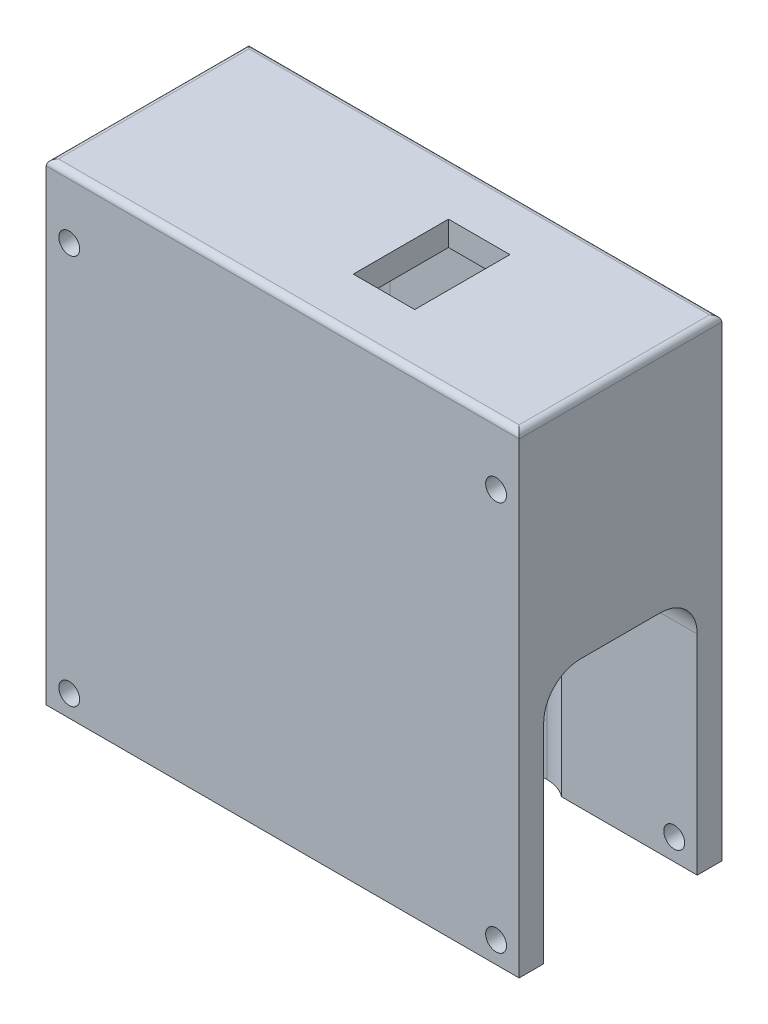
from build123d import *

# Parameters (mm, degrees)
SKETCH_1_W          = 77
SKETCH_1_H          = 33
EXTRUDE_1_DEPTH     = 77
CUT_EXTRUDE_1_DEPTH = 73
SKETCH_3_R          = 1.7
CUT_EXTRUDE_2_DEPTH = 93.196800378
CUT_EXTRUDE_3_DEPTH = 111.13741417
SKETCH_5_W          = 10
SKETCH_5_H          = 15.5
CUT_EXTRUDE_4_DEPTH = 85.163531427
FILLET_1_R          = 1


with BuildPart() as part:
    # ｽｹｯﾁ1 → ﾎﾞｽ - 押し出し1 (new body)
    with BuildSketch(Plane(origin=(0, 0, 0), x_dir=(1, 0, 0), z_dir=(0, 1, 0))):
        Rectangle(SKETCH_1_W, SKETCH_1_H)
    extrude(amount=EXTRUDE_1_DEPTH)

    # ｽｹｯﾁ2 → ｶｯﾄ - 押し出し1 (cut)
    with BuildSketch(Plane.XZ):
        with BuildLine():
            Line((12.75, 13.75), (-12.75, 13.75))
            ThreePointArc((-12.75, 13.75), (-16.992640687, 11.992640687), (-18.75, 7.75))
            Line((-18.75, 7.75), (-18.75, -7.75))
            ThreePointArc((-18.75, -7.75), (-16.992640687, -11.992640687), (-12.75, -13.75))
            Line((-12.75, -13.75), (12.75, -13.75))
            ThreePointArc((12.75, -13.75), (16.992640687, -11.992640687), (18.75, -7.75))
            Line((18.75, -7.75), (18.75, 7.75))
            ThreePointArc((18.75, 7.75), (16.992640687, 11.992640687), (12.75, 13.75))
        make_face()
    extrude(amount=-CUT_EXTRUDE_1_DEPTH, mode=Mode.SUBTRACT)

    # ｽｹｯﾁ3 → ｶｯﾄ - 押し出し2 (cut, through all)
    with BuildSketch(Plane.XY.offset(16.5)):
        with Locations((34.75, 3.5)):
            Circle(SKETCH_3_R)
        with Locations((34.75, 67)):
            Circle(SKETCH_3_R)
        with Locations((-34.75, 67)):
            Circle(SKETCH_3_R)
        with Locations((-34.75, 3.5)):
            Circle(SKETCH_3_R)
    extrude(amount=-CUT_EXTRUDE_2_DEPTH, mode=Mode.SUBTRACT)

    # ｽｹｯﾁ4 → ｶｯﾄ - 押し出し3 (cut, through all)
    with BuildSketch(Plane.ZY.offset(38.5)):
        with BuildLine():
            Line((6.5, 40), (-6.5, 40))
            ThreePointArc((-6.5, 40), (-10.742640687, 38.242640687), (-12.5, 34))
            Line((-12.5, 34), (-12.5, 0))
            Line((-12.5, 0), (12.5, 0))
            Line((12.5, 0), (12.5, 34))
            ThreePointArc((12.5, 34), (10.742640687, 38.242640687), (6.5, 40))
        make_face()
    extrude(amount=-CUT_EXTRUDE_3_DEPTH, mode=Mode.SUBTRACT)

    # ｽｹｯﾁ5 → ｶｯﾄ - 押し出し4 (cut, through all)
    with BuildSketch(Plane.XZ.offset(-73)):
        with Locations((7.75, 0)):
            Rectangle(SKETCH_5_W, SKETCH_5_H)
    extrude(amount=-CUT_EXTRUDE_4_DEPTH, mode=Mode.SUBTRACT)

    # ﾌｨﾚｯﾄ1
    fillet_1_edges = [part.edges().sort_by_distance(p)[0] for p in [
        (0, 77, 16.5),
        (-38.5, 77, 0),
        (0, 77, -16.5),
        (38.5, 77, 0),
    ]]
    fillet(fillet_1_edges, radius=FILLET_1_R)


solid = part.part
